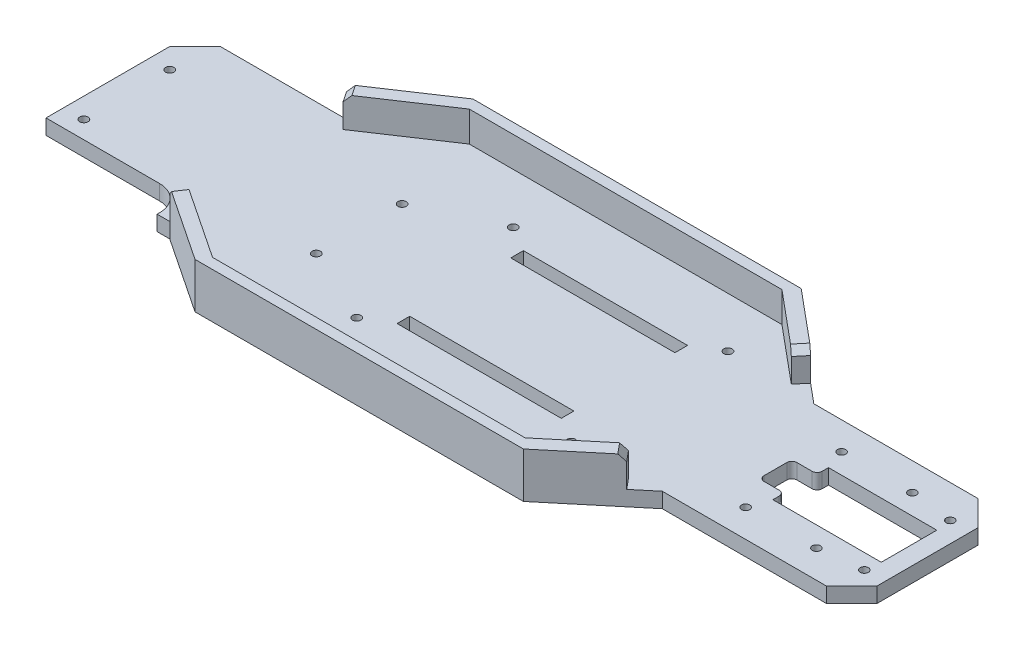
from build123d import *

# Parameters (mm, degrees)
BOSS_EXTRUDE1_DEPTH      = 6
CHASSIS_WALLS1_DEPTH     = 12
CHAMFER1_SIZE            = 10
CHAMFER2_SIZE            = 10
CHAMFER3_SIZE            = 2.5
SKETCH4_R                = 1.65
CUT_EXTRUDE1_DEPTH       = 10
SKETCH5_W                = 55
SKETCH5_H                = 11
CUT_EXTRUDE2_DEPTH       = 10
SKETCH6_W                = 65
SKETCH6_H                = 5
CUT_EXTRUDE3_DEPTH       = 180.078195211
FILLET1_R                = 10
SKETCH7_W                = 42.9
SKETCH7_H                = 22
CUT_EXTRUDE4_DEPTH       = 180.078195211
SKETCH9_R                = 1.625
CUT_EXTRUDE5_DEPTH       = 180.078195211
SKETCH10_W               = 10
SKETCH10_H               = 13
SERVO_CABLE_CUTOUT_DEPTH = 10
FILLET2_R                = 2


with BuildPart() as part:
    # Sketch1 → Boss-Extrude1 (new body)
    with BuildSketch(Plane(origin=(0, 0, 0), x_dir=(1, 0, 0), z_dir=(0, 1, 0))):
        Polygon((-95, 35), (-65, 55), (65, 55), (95, 30), (170, 30), (170, -30), (95, -30), (65, -55), (-65, -55), (-95, -35), (-155, -35), (-155, 35), align=None)
    extrude(amount=BOSS_EXTRUDE1_DEPTH)

    # Sketch3 → Chassis-Walls1 (add)
    with BuildSketch(Plane(origin=(0, 6, 0), x_dir=(1, 0, 0), z_dir=(0, 1, 0))):
        Polygon((0, 55), (-65, 55), (-95, 35), (-92.226499019, 30.839748528), (-62.226499019, 50.839748528), (0, 50.839748528), (61.533123774, 50.839748528), (83.850910978, 32.241592525), (87.317787204, 36.401843997), (65, 55), align=None)
        Polygon((61.533123774, -50.839748528), (0, -50.839748528), (-62.226499019, -50.839748528), (-92.226499019, -30.839748528), (-95, -35), (-65, -55), (0, -55), (65, -55), (87.317787204, -36.401843997), (83.850910978, -32.241592525), align=None)
    extrude(amount=CHASSIS_WALLS1_DEPTH)

    # Chamfer1
    chamfer1_edges = [part.edges().sort_by_distance(p)[0] for p in [
        (-155, 3, -35),
        (-155, 3, 35),
    ]]
    chamfer(chamfer1_edges, length=CHAMFER1_SIZE)

    # Chamfer2
    chamfer2_edges = [part.edges().sort_by_distance(p)[0] for p in [
        (170, 3, -30),
        (170, 3, 30),
    ]]
    chamfer(chamfer2_edges, length=CHAMFER2_SIZE)

    # Chamfer3
    chamfer3_edges = [part.edges().sort_by_distance(p)[0] for p in [
        (-93.613249509, 18, -32.919874264),
        (85.584349091, 18, -34.321718261),
        (-93.613249509, 18, 32.919874264),
        (85.584349091, 18, 34.321718261),
    ]]
    chamfer(chamfer3_edges, length=CHAMFER3_SIZE)

    # Sketch4 → Cut-Extrude1 (cut)
    with BuildSketch(Plane.XZ):
        with Locations((-147, 17)):
            Circle(SKETCH4_R)
        with Locations((-55, 17)):
            Circle(SKETCH4_R)
        with Locations((-55, -17)):
            Circle(SKETCH4_R)
        with Locations((-147, -17)):
            Circle(SKETCH4_R)
        with Locations((-25, 31)):
            Circle(SKETCH4_R)
        with Locations((60, 31)):
            Circle(SKETCH4_R)
        with Locations((60, -31)):
            Circle(SKETCH4_R)
        with Locations((-25, -31)):
            Circle(SKETCH4_R)
    extrude(amount=-CUT_EXTRUDE1_DEPTH, mode=Mode.SUBTRACT)

    # Sketch5 → Cut-Extrude2 (cut)
    with BuildSketch(Plane(origin=(0, 6, 0), x_dir=(1, 0, 0), z_dir=(0, 1, 0))):
        with Locations((-127.5, -29.5)):
            Rectangle(SKETCH5_W, SKETCH5_H)
    extrude(amount=-CUT_EXTRUDE2_DEPTH, mode=Mode.SUBTRACT)

    # Sketch6 → Cut-Extrude3 (cut, through all)
    with BuildSketch(Plane(origin=(0, 6, 0), x_dir=(1, 0, 0), z_dir=(0, 1, 0))):
        with Locations((17.5, 22.5)):
            Rectangle(SKETCH6_W, SKETCH6_H)
        with Locations((17.5, -22.5)):
            Rectangle(SKETCH6_W, SKETCH6_H)
    extrude(amount=-CUT_EXTRUDE3_DEPTH, mode=Mode.SUBTRACT)

    # Fillet1
    fillet1_edges = [part.edges().sort_by_distance(p)[0] for p in [
        (-100, 3, 24),
    ]]
    fillet(fillet1_edges, radius=FILLET1_R)

    # Sketch7 → Cut-Extrude4 (cut, through all)
    with BuildSketch(Plane(origin=(0, 6, 0), x_dir=(1, 0, 0), z_dir=(0, 1, 0))):
        with Locations((141.25, 0)):
            Rectangle(SKETCH7_W, SKETCH7_H)
    extrude(amount=-CUT_EXTRUDE4_DEPTH, mode=Mode.SUBTRACT)

    # Sketch9 → Cut-Extrude5 (cut, through all)
    with BuildSketch(Plane(origin=(0, 6, 0), x_dir=(1, 0, 0), z_dir=(0, 1, 0))):
        with Locations((117, -19)):
            Circle(SKETCH9_R)
        with Locations((145, -19)):
            Circle(SKETCH9_R)
        with Locations((162, -17)):
            Circle(SKETCH9_R)
    cut_extrude5 = extrude(amount=-CUT_EXTRUDE5_DEPTH, mode=Mode.SUBTRACT)

    # Mirror1: Cut-Extrude5 across plane
    add(cut_extrude5.mirror(Plane.XY), mode=Mode.SUBTRACT)

    # Sketch10 → Servo-Cable-Cutout (cut)
    with BuildSketch(Plane(origin=(0, 6, 0), x_dir=(1, 0, 0), z_dir=(0, 1, 0))):
        with Locations((114.8, 0)):
            Rectangle(SKETCH10_W, SKETCH10_H)
    extrude(amount=-SERVO_CABLE_CUTOUT_DEPTH, mode=Mode.SUBTRACT)

    # Fillet2
    fillet2_edges = [part.edges().sort_by_distance(p)[0] for p in [
        (119.8, 3, -6.5),
        (119.8, 3, 6.5),
        (109.8, 3, 6.5),
        (109.8, 3, -6.5),
    ]]
    fillet(fillet2_edges, radius=FILLET2_R)


solid = part.part
